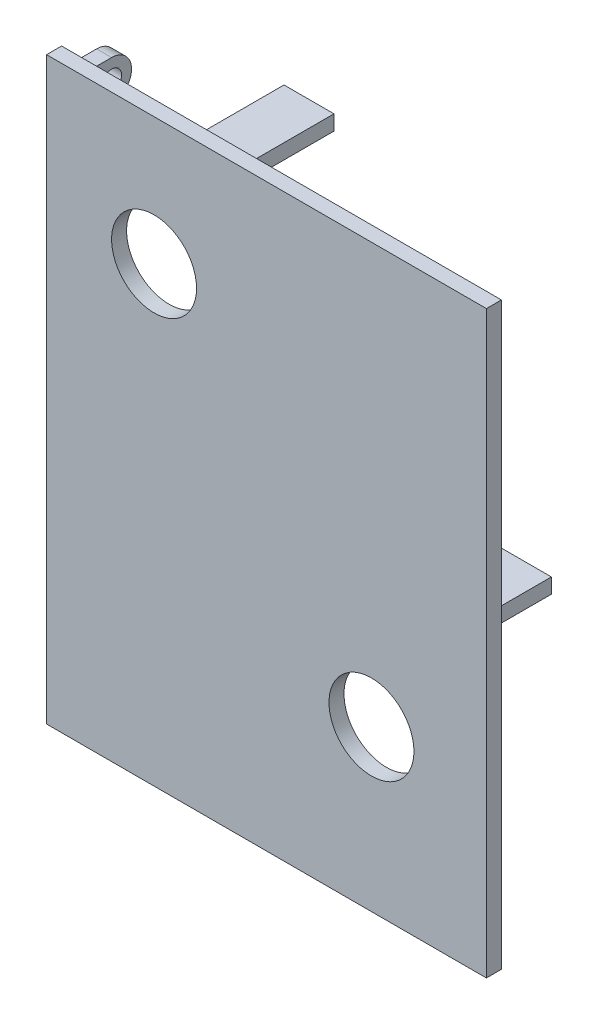
from build123d import *

# Parameters (mm, degrees)
SKETCH1_W           = 88
SKETCH1_H           = 116
BOSS_EXTRUDE1_DEPTH = 3
SKETCH2_R           = 8.5
CUT_EXTRUDE1_DEPTH  = 73.862884928
SKETCH4_R           = 2
BOSS_EXTRUDE3_DEPTH = 3
SKETCH5_W           = 10
SKETCH5_H           = 3
BOSS_EXTRUDE4_DEPTH = 28


with BuildPart() as part:
    # Sketch1 → Boss-Extrude1 (new body)
    with BuildSketch(Plane.XY):
        Rectangle(SKETCH1_W, SKETCH1_H)
    extrude(amount=BOSS_EXTRUDE1_DEPTH)

    # Sketch2 → Cut-Extrude1 (cut, through all)
    with BuildSketch(Plane.XY.offset(3)):
        with Locations((-22.5, 32.5)):
            Circle(SKETCH2_R)
        with Locations((21, -26)):
            Circle(SKETCH2_R)
    extrude(amount=-CUT_EXTRUDE1_DEPTH, mode=Mode.SUBTRACT)

    # Sketch4 → Boss-Extrude3 (add)
    # profile 1 of 2: a face of its own
    with BuildSketch(Plane.ZY.offset(44)):
        with BuildLine():
            Line((-7, 54), (0, 54))
            Line((0, 54), (0, 46))
            Line((0, 46), (-7, 46))
            ThreePointArc((-7, 46), (-11, 50), (-7, 54))
        make_face()
        with Locations((-7, 50)):
            Circle(SKETCH4_R, mode=Mode.SUBTRACT)
    # profile 2 of 2: a face of its own
    with BuildSketch(Plane.ZY.offset(44)):
        with BuildLine():
            Line((0, -46), (-7, -46))
            ThreePointArc((-7, -46), (-11, -50), (-7, -54))
            Line((-7, -54), (0, -54))
            Line((0, -54), (0, -46))
        make_face()
        with Locations((-7, -50)):
            Circle(SKETCH4_R, mode=Mode.SUBTRACT)
    extrude(amount=-BOSS_EXTRUDE3_DEPTH)

    # Sketch5 → Boss-Extrude4 (add)
    with BuildSketch(Plane(origin=(0, 0, 0), x_dir=(-1, 0, 0), z_dir=(0, 0, -1))):
        with Locations((22.5, 44)):
            Rectangle(SKETCH5_W, SKETCH5_H)
        with Locations((-21, -14.5)):
            Rectangle(SKETCH5_W, SKETCH5_H)
    extrude(amount=BOSS_EXTRUDE4_DEPTH)


solid = part.part
